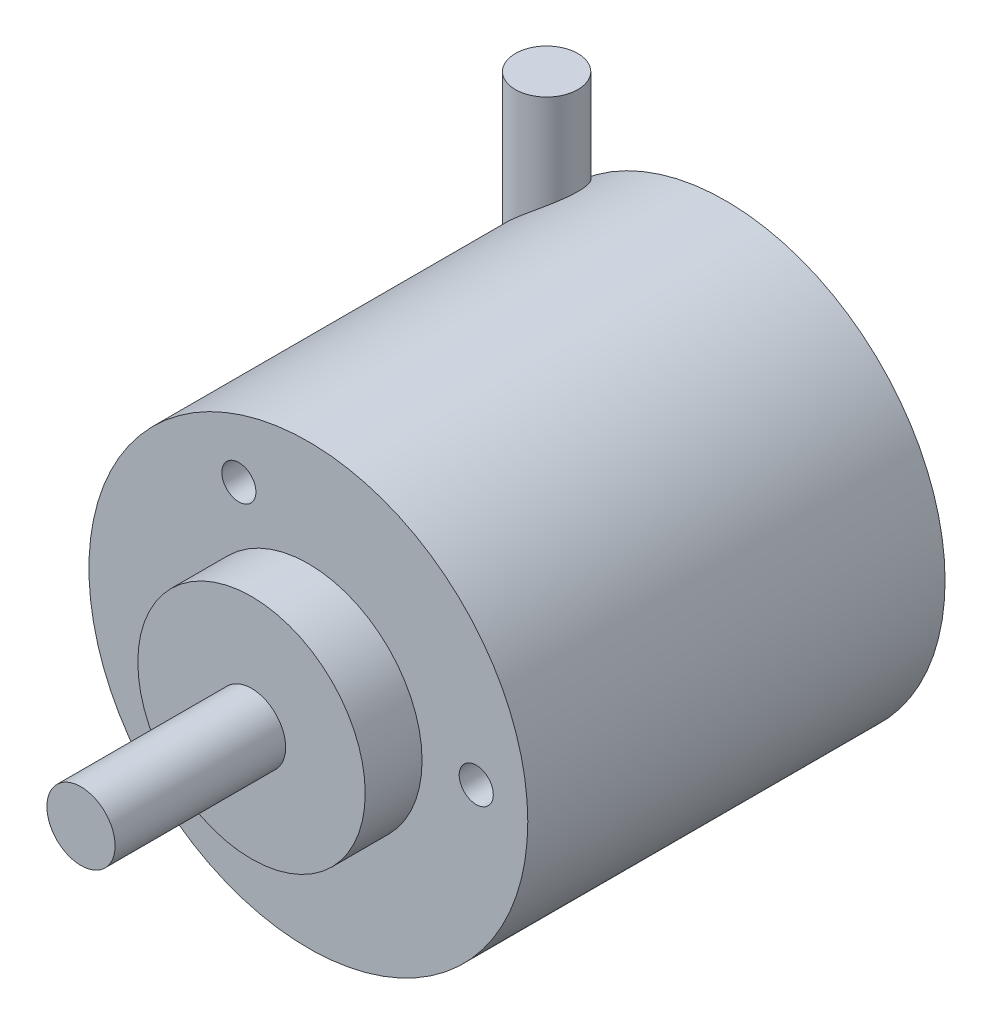
from build123d import *

# Parameters (mm, degrees)
SKETCH1_R           = 19.3
BOSS_EXTRUDE1_DEPTH = 36.7
SKETCH3_R           = 10
BOSS_EXTRUDE2_DEPTH = 5
SKETCH4_R           = 3
BOSS_EXTRUDE3_DEPTH = 15
SKETCH5_R           = 1.5
CUT_EXTRUDE1_DEPTH  = 5
SKETCH6_R           = 1.5
CUT_EXTRUDE2_DEPTH  = 5
SKETCH7_R           = 1.5
CUT_EXTRUDE3_DEPTH  = 5
SKETCH8_R           = 2.75
BOSS_EXTRUDE4_DEPTH = 15
SKETCH9_R           = 2.75
BOSS_EXTRUDE5_DEPTH = 5


with BuildPart() as part:
    # Sketch1 → Boss-Extrude1 (new body)
    with BuildSketch(Plane.XY):
        with Locations((-14.127422454, 5.37928778)):
            Circle(SKETCH1_R)
    extrude(amount=BOSS_EXTRUDE1_DEPTH)

    # Sketch3 → Boss-Extrude2 (add)
    with BuildSketch(Plane.XY.offset(36.7)):
        with Locations((-14.127422454, 5.37928778)):
            Circle(SKETCH3_R)
    extrude(amount=BOSS_EXTRUDE2_DEPTH)

    # Sketch4 → Boss-Extrude3 (add)
    with BuildSketch(Plane.XY.offset(41.7)):
        with Locations((-14.127422454, 5.37928778)):
            Circle(SKETCH4_R)
    extrude(amount=BOSS_EXTRUDE3_DEPTH)

    # Sketch5 → Cut-Extrude1 (cut)
    with BuildSketch(Plane.XY.offset(36.7)):
        with Locations((0.637713277, 5.908417868)):
            Circle(SKETCH5_R)
    extrude(amount=-CUT_EXTRUDE1_DEPTH, mode=Mode.SUBTRACT)

    # Sketch6 → Cut-Extrude2 (cut)
    with BuildSketch(Plane.XY.offset(36.7)):
        with Locations((-20.240175516, 18.521490832)):
            Circle(SKETCH6_R)
    extrude(amount=-CUT_EXTRUDE2_DEPTH, mode=Mode.SUBTRACT)

    # Sketch7 → Cut-Extrude3 (cut)
    with BuildSketch(Plane.XY.offset(36.7)):
        with Locations((-20.268967513, -8.045990374)):
            Circle(SKETCH7_R)
    extrude(amount=-CUT_EXTRUDE3_DEPTH, mode=Mode.SUBTRACT)



with BuildPart() as body_2:
    # Sketch8 → Boss-Extrude4 (new body)
    with BuildSketch(Plane(origin=(0, 24.67928778, 0), x_dir=(1, 0, 0), z_dir=(0, 1, 0))):
        with Locations((-26.832117877, -3.04260895)):
            Circle(SKETCH8_R)
    extrude(amount=-BOSS_EXTRUDE4_DEPTH)


with BuildPart() as part_1:
    add(part.part)

    add(body_2.part)  # Boss-Extrude5 merges body 2
    # Sketch9 → Boss-Extrude5 (add)
    with BuildSketch(Plane(origin=(0, 24.67928778, 0), x_dir=(1, 0, 0), z_dir=(0, 1, 0))):
        with Locations((-26.832117877, -3.04260895)):
            Circle(SKETCH9_R)
    extrude(amount=BOSS_EXTRUDE5_DEPTH)


solid = part_1.part
